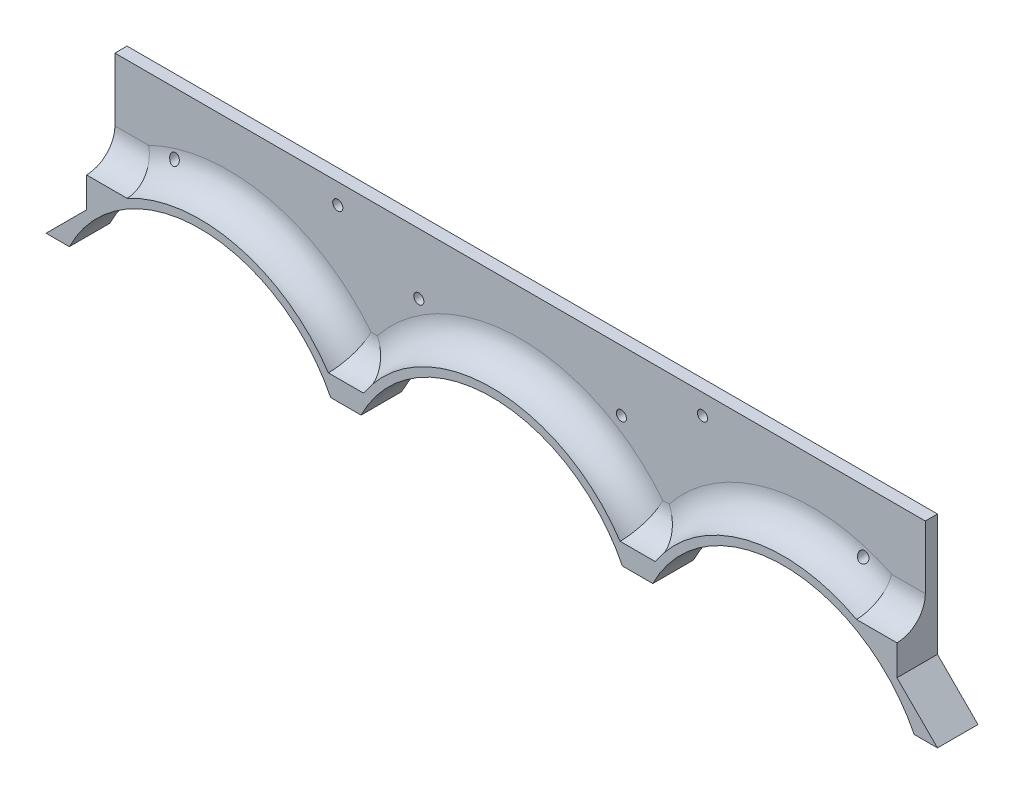
from build123d import *

# Parameters (mm, degrees)
MAIN_DEPTH          = 10
BACKCUT_DEPTH       = 7
FILLET1_R           = 7
FIXHOLES_DEPTH      = 118.256129904
FIXHOLES_DEPTH_BACK = 118.256129904
SKETCH3_R           = 1.25


with BuildPart() as part:
    # Sketch1 → Main (new body)
    with BuildSketch(Plane.XY):
        with BuildLine():
            Line((-100, 0), (100, 0))
            Line((100, 0), (100, -30))
            Line((100, -30), (110, -40))
            Line((110, -40), (104.24709298, -40))
            ThreePointArc((104.24709298, -40), (71.998061986, -20), (39.749030993, -40))
            Line((39.749030993, -40), (32.249030993, -40))
            ThreePointArc((32.249030993, -40), (0, -20), (-32.249030993, -40))
            Line((-32.249030993, -40), (-39.749030993, -40))
            ThreePointArc((-39.749030993, -40), (-71.998061986, -20), (-104.24709298, -40))
            Line((-104.24709298, -40), (-110, -40))
            Line((-110, -40), (-100, -30))
            Line((-100, -30), (-100, 0))
        make_face()
    extrude(amount=MAIN_DEPTH)

    # Sketch2 → BackCut (cut)
    with BuildSketch(Plane.XY.offset(10)):
        with BuildLine():
            Line((-100, 0), (100, 0))
            Line((100, 0), (100, -22.534641377))
            Line((100, -22.534641377), (90, -22.534641377))
            ThreePointArc((90, -22.534641377), (62.748658295, -19.142863224), (40.327886742, -35))
            Line((40.327886742, -35), (31.670175244, -35))
            ThreePointArc((31.670175244, -35), (0, -18), (-31.670175244, -35))
            Line((-31.670175244, -35), (-40.327886742, -35))
            ThreePointArc((-40.327886742, -35), (-62.748658295, -19.142863224), (-90, -22.534641377))
            Line((-90, -22.534641377), (-100, -22.534641377))
            Line((-100, -22.534641377), (-100, 0))
        make_face()
    extrude(amount=-BACKCUT_DEPTH, mode=Mode.SUBTRACT)

    # Fillet1
    fillet1_edges = [part.edges().sort_by_distance(p)[0] for p in [
        (-62.748658295, -19.142863224, 3),
        (-95, -22.534641377, 3),
        (0, -18, 3),
        (95, -22.534641377, 3),
        (62.748658295, -19.142863224, 3),
        (-35.999030993, -35, 3),
        (35.999030993, -35, 3),
    ]]
    fillet(fillet1_edges, radius=FILLET1_R - 0.0001)  # a hair under: the kernel refuses the full size

    # Sketch3 → FixHoles (cut, two sides: drawn at the far end of the back side and taken through both)
    with BuildSketch(Plane.XY.offset(3).offset(-FIXHOLES_DEPTH_BACK)):
        with Locations((-45, -5)):
            Circle(SKETCH3_R)
        with Locations((45, -5)):
            Circle(SKETCH3_R)
        with Locations((-25, -15)):
            Circle(SKETCH3_R)
        with Locations((25, -15)):
            Circle(SKETCH3_R)
        with Locations((-85, -15)):
            Circle(SKETCH3_R)
        with Locations((85, -15)):
            Circle(SKETCH3_R)
    extrude(amount=FIXHOLES_DEPTH + FIXHOLES_DEPTH_BACK, mode=Mode.SUBTRACT)


solid = part.part
